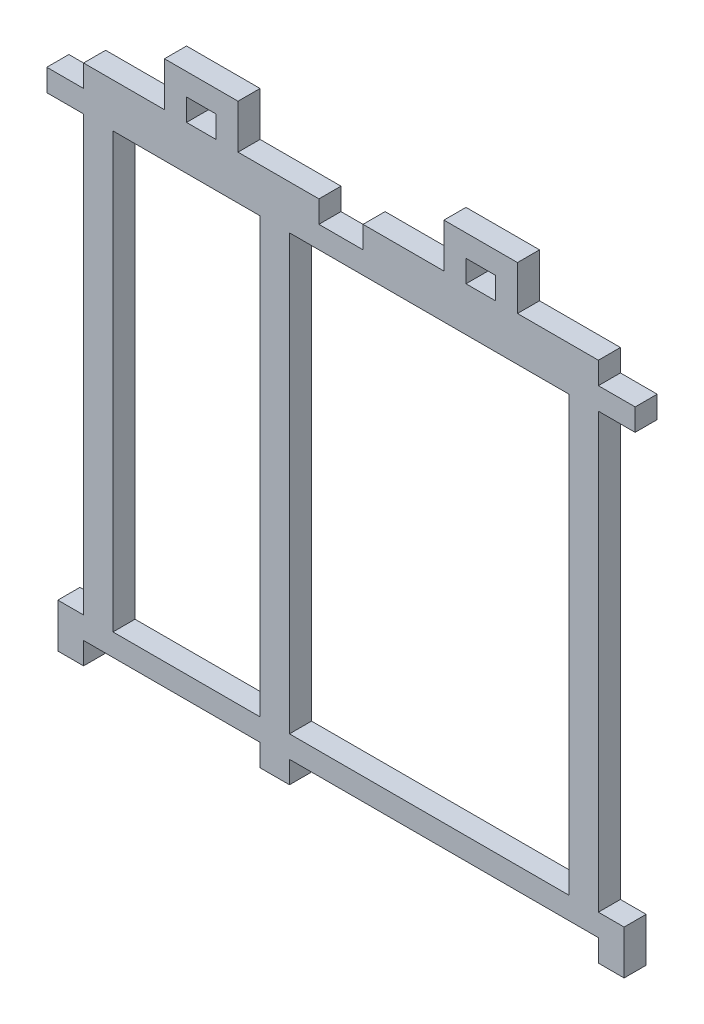
from build123d import *

# Parameters (mm, degrees)
SKETCH1_W           = 20
SKETCH1_H           = 59
SKETCH1_W_2         = 38
BOSS_EXTRUDE1_DEPTH = 3
BOSS_EXTRUDE2_DEPTH = 3


with BuildPart() as part:
    # Sketch1 → Boss-Extrude1 (new body)
    with BuildSketch(Plane.XY):
        Polygon((5, -3), (0, -3), (0, 0), (5, 0), (5, 3), (37, 3), (37, 0), (43, 0), (43, 3), (75, 3), (75, 0), (80, 0), (80, -3), (75, -3), (75, -62), (78.5, -62), (78.5, -68), (75, -68), (75, -65), (33, -65), (33, -68), (29, -68), (29, -65), (5, -65), (5, -68), (1.5, -68), (1.5, -62), (5, -62), align=None)
        with Locations((19, -32.5)):
            Rectangle(SKETCH1_W, SKETCH1_H, mode=Mode.SUBTRACT)
        with Locations((52, -32.5)):
            Rectangle(SKETCH1_W_2, SKETCH1_H, mode=Mode.SUBTRACT)
    extrude(amount=BOSS_EXTRUDE1_DEPTH)

    # Sketch2 → Boss-Extrude2 (add)
    with BuildSketch(Plane.XY.offset(3)):
        Polygon((16, 9), (16, 3), (19, 3), (19, 6), (23, 6), (23, 3), (26, 3), (26, 9), align=None)
        Polygon((54, 3), (57, 3), (57, 6), (61, 6), (61, 3), (64, 3), (64, 9), (54, 9), align=None)
    extrude(amount=-BOSS_EXTRUDE2_DEPTH)


solid = part.part
